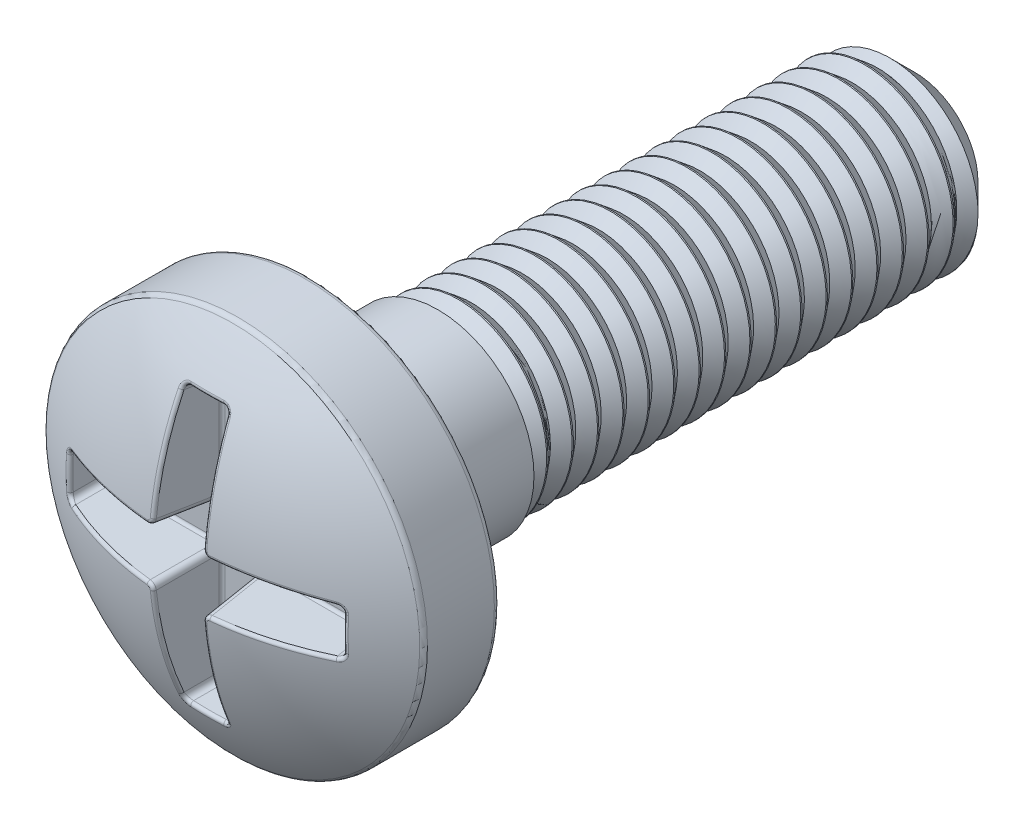
from build123d import *

# Parameters (mm, degrees)
CHAMFER1_SIZE    = 0.8128
SKETCH2_R        = 3.000595162
SKETCH2_R_2      = 2.2733
EXTRUDE1_DEPTH   = 14.224
CUT_SWEEP1_PITCH = 0.635
CUT_SWEEP1_FROM  = 0
EXTRUDE2_START   = -2.54
SKETCH5_R        = 2.4003
EXTRUDE2_DEPTH   = 2.54
EXTRUDE3_DEPTH   = 1.651
EXTRUDE3_DRAFT   = -5
FILLET1_R        = 0.1524
FILLET2_R        = 0.0762


with BuildPart() as part:
    # Sketch1 → Revolve1 (revolve)
    with BuildSketch(Plane(origin=(0, 0, 0), x_dir=(0, 0, -1), z_dir=(1, 0, 0)), mode=Mode.PRIVATE) as revolve1_sk:
        with BuildLine():
            Line((18.4658, 0), (18.4658, 2.4003))
            Line((18.4658, 2.4003), (3.3782, 2.4003))
            Line((3.3782, 2.4003), (3.3782, 4.7371))
            Line((3.3782, 4.7371), (1.4732, 4.7371))
            ThreePointArc((1.4732, 4.7371), (0.376798879, 2.480445255), (0, 0))
            Line((0, 0), (18.4658, 0))
        make_face()
    revolve(revolve1_sk.sketch.rotate(Axis((0, 0, 0), (0, 0, -1)), 90), axis=Axis((0, 0, 0), (0, 0, -1)))

    # Chamfer1
    chamfer1_edges = [part.edges().sort_by_distance(p)[0] for p in [
        (-2.4003, 0, -18.4658),
    ]]
    chamfer(chamfer1_edges, length=CHAMFER1_SIZE)

    # Sketch2 → Extrude1 (cut)
    with BuildSketch(Plane(origin=(0, 0, -6.5532), x_dir=(-1, 0, 0), z_dir=(0, 0, -1))):
        Circle(SKETCH2_R)
        with Locations(Location((0, 0, 0), (0, 0, 180))):
            Circle(SKETCH2_R_2, mode=Mode.SUBTRACT)
    extrude(amount=EXTRUDE1_DEPTH, mode=Mode.SUBTRACT)

    # Cut-Sweep1: arcs per turn and ends read off the stored shape
    # Cut-Sweep1: the profile of Sketch4 profile screwed along a left-hand helix through 21 turns, 6 arcs to a turn; built about Z, then put on its axis
    cut_sweep1_z = Axis((0, 0, 0), (0, 0, 1))
    cut_sweep1_corners = [(2.2736, 0, -0.47662302), (2.031172002, 0, -0.175187961), (2.2736, 0, 0.126247098)]
    with BuildLine(mode=Mode.PRIVATE) as cut_sweep1_profile:
        Line(cut_sweep1_corners[0], cut_sweep1_corners[1])
        Line(cut_sweep1_corners[1], cut_sweep1_corners[2])
        Line(cut_sweep1_corners[2], cut_sweep1_corners[0])
    cut_sweep1_cap = Face(cut_sweep1_profile.wire())
    cut_sweep1_turn_angles = [0, -30, -60, -90, -120, -150, -180, -210, -240, -270, -300, -330, -360]
    cut_sweep1_turn_weights = [1, 0.8660254037844387, 1, 0.8660254037844387, 1, 0.8660254037844387, 1, 0.8660254037844387, 1, 0.8660254037844387, 1, 0.8660254037844387, 1]
    cut_sweep1_turn_rails = [Edge.make_bspline([Vector(p[0], p[1], 0).rotate(cut_sweep1_z, cut_sweep1_turn_angles[k]) / cut_sweep1_turn_weights[k] + Vector(0, 0, p[2] + -CUT_SWEEP1_PITCH * cut_sweep1_turn_angles[k] / 360) for k in range(13)], [0, 0, 0, 1, 1, 2, 2, 3, 3, 4, 4, 5, 5, 6, 6, 6], 2, cut_sweep1_turn_weights) for p in cut_sweep1_corners]
    cut_sweep1_turn_sides = [Face.make_surface_from_curves(cut_sweep1_turn_rails[p[0]], cut_sweep1_turn_rails[p[1]]) for p in [(0, 1), (1, 2), (2, 0)]]
    cut_sweep1 = Plane(origin=(0, 0, -6.5532), x_dir=(-1, 0, 0), z_dir=(0, 0, -1)) * split(Solid(Shell([*[p.moved(Location((0, 0, CUT_SWEEP1_PITCH * i))) for i in range(21) for p in cut_sweep1_turn_sides], cut_sweep1_cap, cut_sweep1_cap.rotate(cut_sweep1_z, -7560).moved(Location((0, 0, -CUT_SWEEP1_PITCH * -7560 / 360)))])), bisect_by=Plane.XY.offset(CUT_SWEEP1_FROM), keep=Keep.TOP, mode=Mode.PRIVATE)
    add(cut_sweep1, mode=Mode.SUBTRACT)

    # Sketch5 → Extrude2 (add)
    with BuildSketch(Plane(origin=(0, 0, -6.5532), x_dir=(-1, 0, 0), z_dir=(0, 0, -1)).offset(EXTRUDE2_START)):
        with Locations(Location((0, 0, 0), (0, 0, 180))):
            Circle(SKETCH5_R)
    extrude(amount=EXTRUDE2_DEPTH)


with BuildPart() as extrude3_tool:
    # Sketch6 → Extrude3 (with draft: the straight prism first)
    with BuildSketch(Plane.XY):
        Polygon((-0.635, 0.635), (-3.4925, 0.635), (-3.4925, -0.635), (-0.635, -0.635), (-0.635, -3.4925), (0.635, -3.4925), (0.635, -0.635), (3.4925, -0.635), (3.4925, 0.635), (0.635, 0.635), (0.635, 3.4925), (-0.635, 3.4925), align=None)
    extrude(amount=-EXTRUDE3_DEPTH)
    # Extrude3: the draft: its side faces are tilted about the plane it starts from
    extrude3_sides = [extrude3_tool.faces().sort_by_distance(p)[0] for p in [
        (-2.06375, 0.635, -0.8255),
        (-3.4925, 0, -0.8255),
        (-2.06375, -0.635, -0.8255),
        (-0.635, -2.06375, -0.8255),
        (0, -3.4925, -0.8255),
        (0.635, -2.06375, -0.8255),
        (2.06375, -0.635, -0.8255),
        (3.4925, 0, -0.8255),
        (2.06375, 0.635, -0.8255),
        (0.635, 2.06375, -0.8255),
        (0, 3.4925, -0.8255),
        (-0.635, 2.06375, -0.8255),
    ]]
    draft(extrude3_sides, Plane.XY, EXTRUDE3_DRAFT)


with BuildPart() as part_1:
    add(part.part)

    # Extrude3: cut by extrude3_tool
    add(extrude3_tool.part, mode=Mode.SUBTRACT)

    # Fillet1
    fillet1_edges = [part_1.edges().sort_by_distance(p)[0] for p in [
        (-0.529691521, -3.387191521, -1.203681427),
        (-0.560688095, -0.560688095, -0.849388956),
        (-3.387191521, -0.529691521, -1.203681427),
        (-3.387191521, 0.529691521, -1.203681427),
        (-0.560688095, 0.560688095, -0.849388956),
        (-0.529691521, 3.387191521, -1.203681427),
        (0.529691521, 3.387191521, -1.203681427),
        (0.560688095, 0.560688095, -0.849388956),
        (3.387191521, 0.529691521, -1.203681427),
        (3.387191521, -0.529691521, -1.203681427),
        (0.560688095, -0.560688095, -0.849388956),
        (0.529691521, -3.387191521, -1.203681427),
        (-4.7371, 0, -3.3782),
        (-4.7371, 0, -1.4732),
    ]]
    fillet(fillet1_edges, radius=FILLET1_R)

    # Fillet2
    fillet2_edges = [part_1.edges().sort_by_distance(p)[0] for p in [
        (0, -3.348056217, -1.651),
        (-0.490556217, -1.919306217, -1.651),
        (0.490556217, -1.919306217, -1.651),
        (1.919306217, -0.490556217, -1.651),
        (3.348056217, 0, -1.651),
        (1.919306217, 0.490556217, -1.651),
        (0.490556217, 1.919306217, -1.651),
        (0, 3.348056217, -1.651),
        (-0.490556217, 1.919306217, -1.651),
        (-1.919306217, 0.490556217, -1.651),
        (-3.348056217, 0, -1.651),
        (-1.919306217, -0.490556217, -1.651),
        (-0.446158861, 3.303658861, -1.651),
        (0.446158861, 3.303658861, -1.651),
        (3.303658861, 0.446158861, -1.651),
        (3.303658861, -0.446158861, -1.651),
        (0.446158861, -3.303658861, -1.651),
        (-3.303658861, -0.446158861, -1.651),
        (-3.303658861, 0.446158861, -1.651),
        (-0.446158861, -3.303658861, -1.651),
        (-0.527732641, -3.382555223, -0.733813253),
        (-3.382555223, 0.527732641, -0.733813253),
        (-3.382555223, -0.527732641, -0.733813252),
        (-0.534953572, -0.534953572, -1.651),
        (0.527732641, -3.382555223, -0.733813252),
        (0.534953572, -0.534953572, -1.651),
        (3.382555223, -0.527732641, -0.733813253),
        (3.382555223, 0.527732641, -0.733813253),
        (0.534953572, 0.534953572, -1.651),
        (0.527732641, 3.382555223, -0.733813253),
        (-0.527732641, 3.382555223, -0.733813252),
        (-0.534953572, 0.534953572, -1.651),
        (0, -3.428117026, -0.735900763),
        (-0.6105118, -2.055432575, -0.279901412),
        (-2.055432575, -0.6105118, -0.279901412),
        (-3.428117026, 0, -0.735900763),
        (-2.055432575, 0.6105118, -0.279901412),
        (-0.6105118, 2.055432575, -0.279901412),
        (0, 3.428117026, -0.735900763),
        (0.6105118, 2.055432575, -0.279901412),
        (2.055432575, 0.6105118, -0.279901412),
        (3.427875647, -0.208989196, -0.738659739),
        (2.055432575, -0.6105118, -0.279901412),
        (0.6105118, -2.055432575, -0.279901412),
        (-0.674614807, 0.674614807, -0.054664782),
        (0.674614807, 0.674614807, -0.054664782),
        (0.674614807, -0.674614807, -0.054664782),
        (-0.674614807, -0.674614807, -0.054664782),
    ]]
    fillet(fillet2_edges, radius=FILLET2_R)


solid = part_1.part
